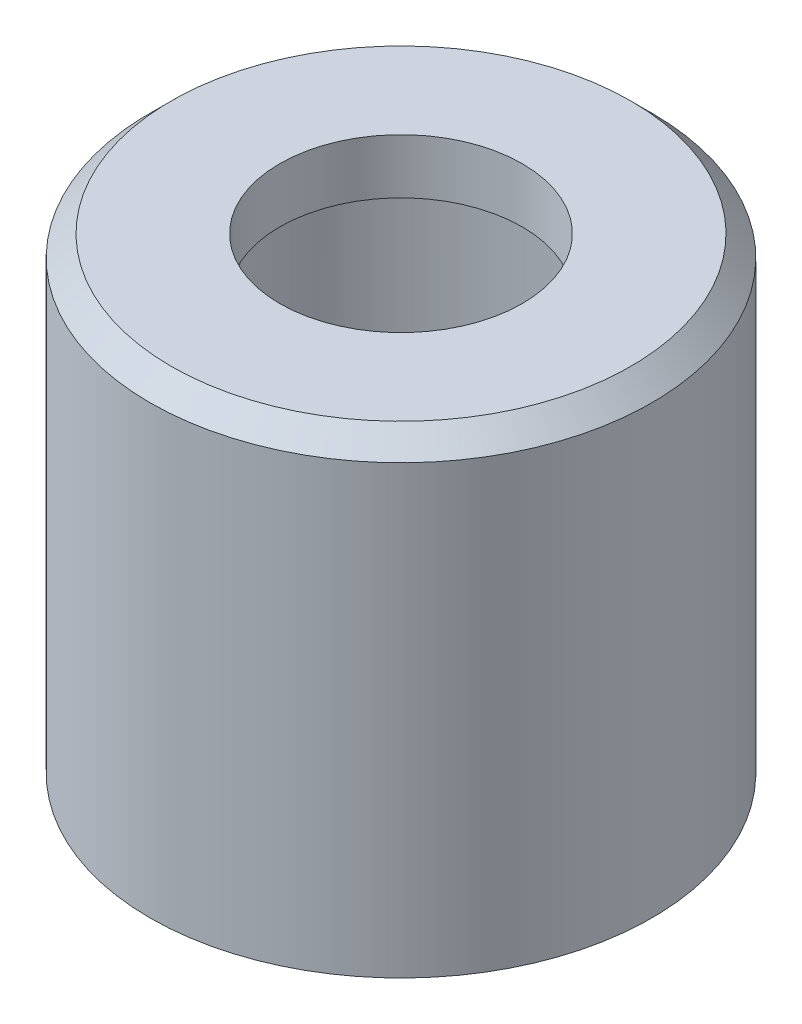
from build123d import *
from build123d.topology import SkipClean

# Parameters (mm, degrees)
SKETCH1_R           = 2.98
BOSS_EXTRUDE1_DEPTH = 5.55
SKETCH2_R           = 2.5
CUT_EXTRUDE1_DEPTH  = 4.9
SKETCH3_R           = 1.44
CUT_EXTRUDE2_DEPTH  = 7.968737332
CHAMFER1_SIZE       = 0.25
THREAD1_PITCH       = 0.8


with BuildPart() as part:
    # Sketch1 → Boss-Extrude1 (new body)
    with BuildSketch(Plane(origin=(0, 0, 0), x_dir=(1, 0, 0), z_dir=(0, 1, 0))):
        with Locations(Location((0, 0, 0), (0, 0, 270))):
            Circle(SKETCH1_R)
    extrude(amount=BOSS_EXTRUDE1_DEPTH)

    # Sketch2 → Cut-Extrude1 (cut)
    with BuildSketch(Plane.XZ):
        with Locations(Location((0, 0, 0), (0, 0, 270))):
            Circle(SKETCH2_R)
    extrude(amount=-CUT_EXTRUDE1_DEPTH, mode=Mode.SUBTRACT)

    # Sketch3 → Cut-Extrude2 (cut, through all)
    with BuildSketch(Plane(origin=(0, 5.55, 0), x_dir=(1, 0, 0), z_dir=(0, 1, 0))):
        with Locations(Location((0, 0, 0), (0, 0, 270))):
            Circle(SKETCH3_R)
    extrude(amount=-CUT_EXTRUDE2_DEPTH, mode=Mode.SUBTRACT)

    # Chamfer1
    chamfer1_edges = [part.edges().sort_by_distance(p)[0] for p in [
        (0, 5.55, -2.98),
    ]]
    chamfer(chamfer1_edges, length=CHAMFER1_SIZE)

    # Thread1: the profile of Thread Profile1 profile screwed along a right-hand helix of 2.5 turns, 8 arcs to a turn; built about Z, then put on its axis
    with SkipClean():  # the faces are left unmerged after this step: merging them gives an invalid solid
        thread1_z = Axis((0, 0, 0), (0, 0, 1))
        thread1_corners = [(2.4997, 0, -0.000173205), (2.9330127, 0, 0.249999999), (2.9330127, 0, 0.349999999), (2.4997, 0, 0.600173203)]
        with BuildLine(mode=Mode.PRIVATE) as thread1_profile:
            Line(thread1_corners[0], thread1_corners[1])
            Line(thread1_corners[1], thread1_corners[2])
            Line(thread1_corners[2], thread1_corners[3])
            Line(thread1_corners[3], thread1_corners[0])
        thread1_cap = Face(thread1_profile.wire())
        thread1_turn_angles = [0, 22.5, 45, 67.5, 90, 112.5, 135, 157.5, 180, 202.5, 225, 247.5, 270, 292.5, 315, 337.5, 360]
        thread1_turn_weights = [1, 0.9238795325112867, 1, 0.9238795325112867, 1, 0.9238795325112867, 1, 0.9238795325112867, 1, 0.9238795325112867, 1, 0.9238795325112867, 1, 0.9238795325112867, 1, 0.9238795325112867, 1]
        thread1_turn_rails = [Edge.make_bspline([Vector(p[0], p[1], 0).rotate(thread1_z, thread1_turn_angles[k]) / thread1_turn_weights[k] + Vector(0, 0, p[2] + THREAD1_PITCH * thread1_turn_angles[k] / 360) for k in range(17)], [0, 0, 0, 1, 1, 2, 2, 3, 3, 4, 4, 5, 5, 6, 6, 7, 7, 8, 8, 8], 2, thread1_turn_weights) for p in thread1_corners]
        thread1_turn_sides = [Face.make_surface_from_curves(thread1_turn_rails[p[0]], thread1_turn_rails[p[1]]) for p in [(0, 1), (1, 2), (2, 3), (3, 0)]]
        thread1_last_angles = [720, 742.5, 765, 787.5, 810, 832.5, 855, 877.5, 900]
        thread1_last_weights = [1, 0.9238795325112867, 1, 0.9238795325112867, 1, 0.9238795325112867, 1, 0.9238795325112867, 1]
        thread1_last_rails = [Edge.make_bspline([Vector(p[0], p[1], 0).rotate(thread1_z, thread1_last_angles[k]) / thread1_last_weights[k] + Vector(0, 0, p[2] + THREAD1_PITCH * thread1_last_angles[k] / 360) for k in range(9)], [0, 0, 0, 1, 1, 2, 2, 3, 3, 4, 4, 4], 2, thread1_last_weights) for p in thread1_corners]
        thread1_last_sides = [Face.make_surface_from_curves(thread1_last_rails[p[0]], thread1_last_rails[p[1]]) for p in [(0, 1), (1, 2), (2, 3), (3, 0)]]
        thread1 = Plane(origin=(0, 0, 0), x_dir=(1, 0, 0), z_dir=(0, 1, 0)) * Solid(Shell([*[p.moved(Location((0, 0, THREAD1_PITCH * i))) for i in range(2) for p in thread1_turn_sides], *thread1_last_sides, thread1_cap, thread1_cap.rotate(thread1_z, 900).moved(Location((0, 0, THREAD1_PITCH * 900 / 360)))]))
        add(thread1, mode=Mode.SUBTRACT)


solid = part.part
